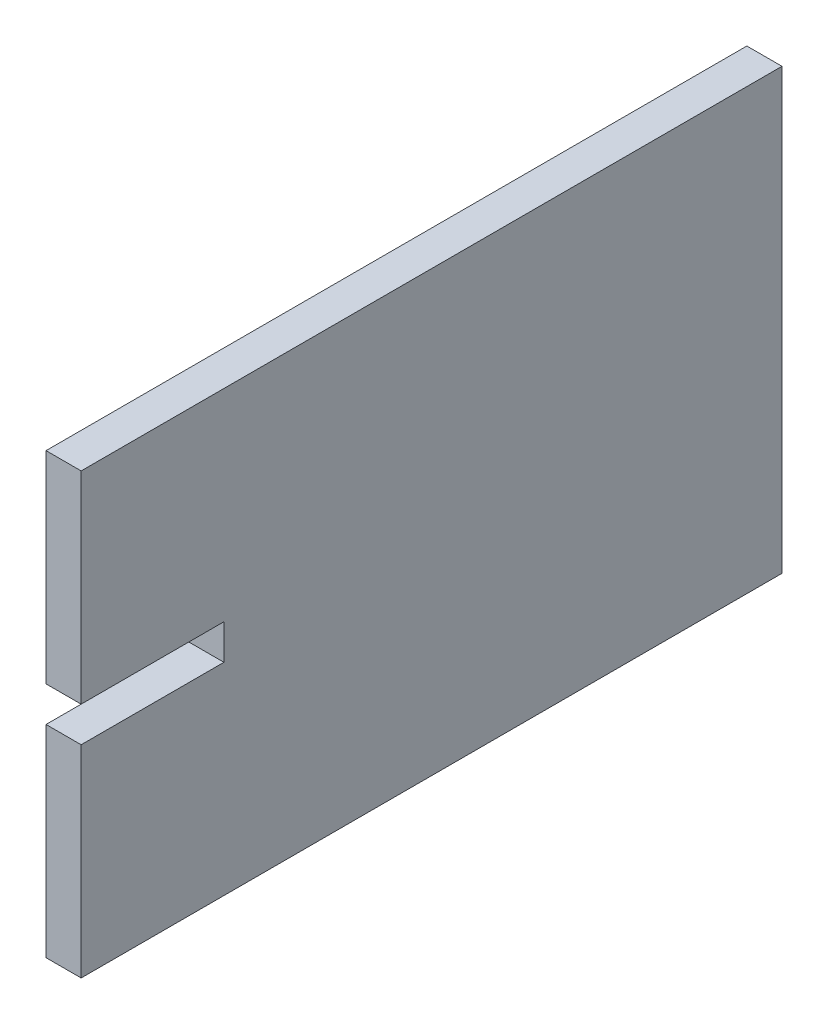
from build123d import *

# Parameters (mm, degrees)
BOSS_EXTRUDE1_DEPTH = 4


with BuildPart() as part:
    # Sketch1 → Boss-Extrude1 (new, symmetric)
    with BuildSketch(Plane(origin=(0, 0, 0), x_dir=(0, 0, -1), z_dir=(1, 0, 0))):
        Polygon((145.78039771, 50), (145.78039771, -50), (-13.806451613, -50), (-13.806451613, -4), (18.709677419, -4), (18.709677419, 4), (-13.806451613, 4), (-13.806451613, 50), align=None)
    extrude(amount=BOSS_EXTRUDE1_DEPTH, both=True)


solid = part.part
